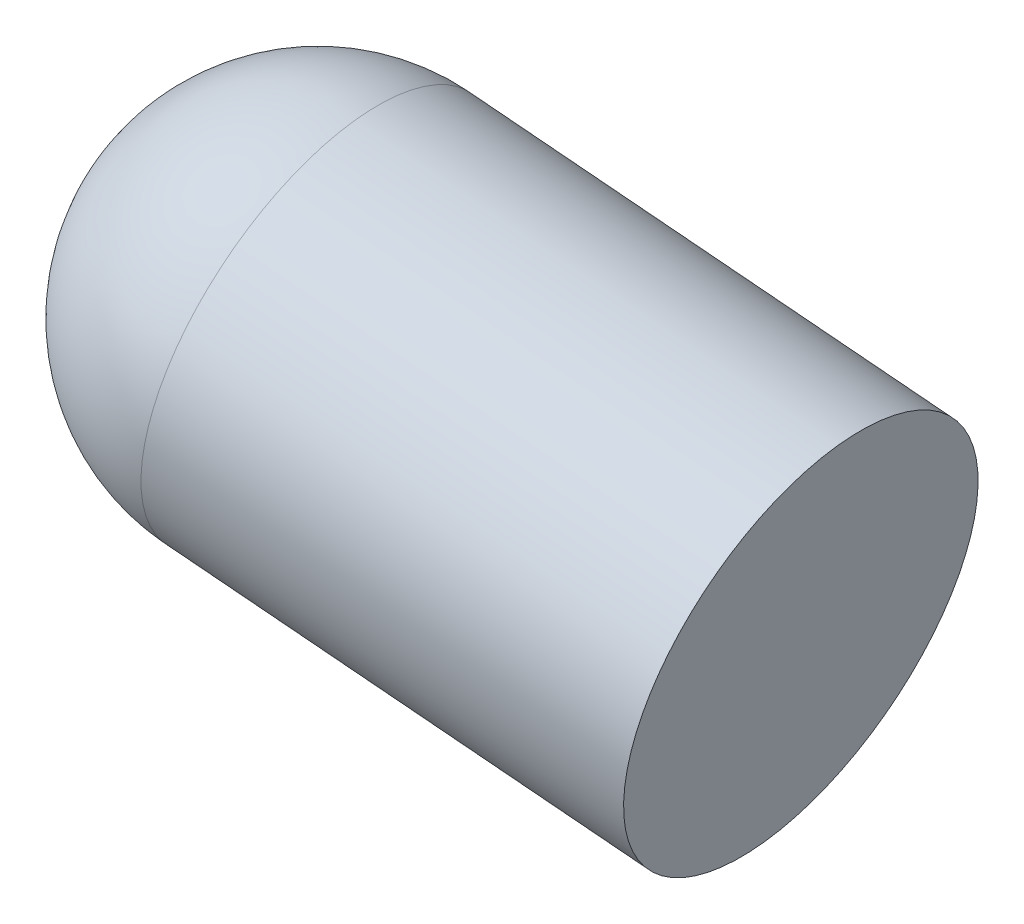
from build123d import *

# Parameters (mm, degrees)
SKETCH3_R           = 15
BOSS_EXTRUDE2_DEPTH = 50
FILLET2_R           = 15


# Read off the part's stored shape, not the designer's step: Bill Native-24-surface1
with BuildPart() as part:
    # Sketch3 → Boss-Extrude2 (new body)
    with BuildSketch(Plane(origin=(-228.533654814, 43.49726387, 22.444633169), x_dir=(0.09433999088090143, -0.017955917609401736, 0.9953780945667812), z_dir=(-0.9778241994721284, 0.18611121962441501, 0.09603358192113938))):
        with Locations(Location((-115.613668098, 187.717913912, 0), (0, 0, 270))):
            Circle(SKETCH3_R)
    extrude(amount=BOSS_EXTRUDE2_DEPTH)

    # Fillet2
    fillet2_edges = [part.edges().sort_by_distance(p)[0] for p in [
        (-250.428593684, 254.021675898, -87.833000391),
    ]]
    fillet(fillet2_edges, radius=FILLET2_R)


solid = part.part
